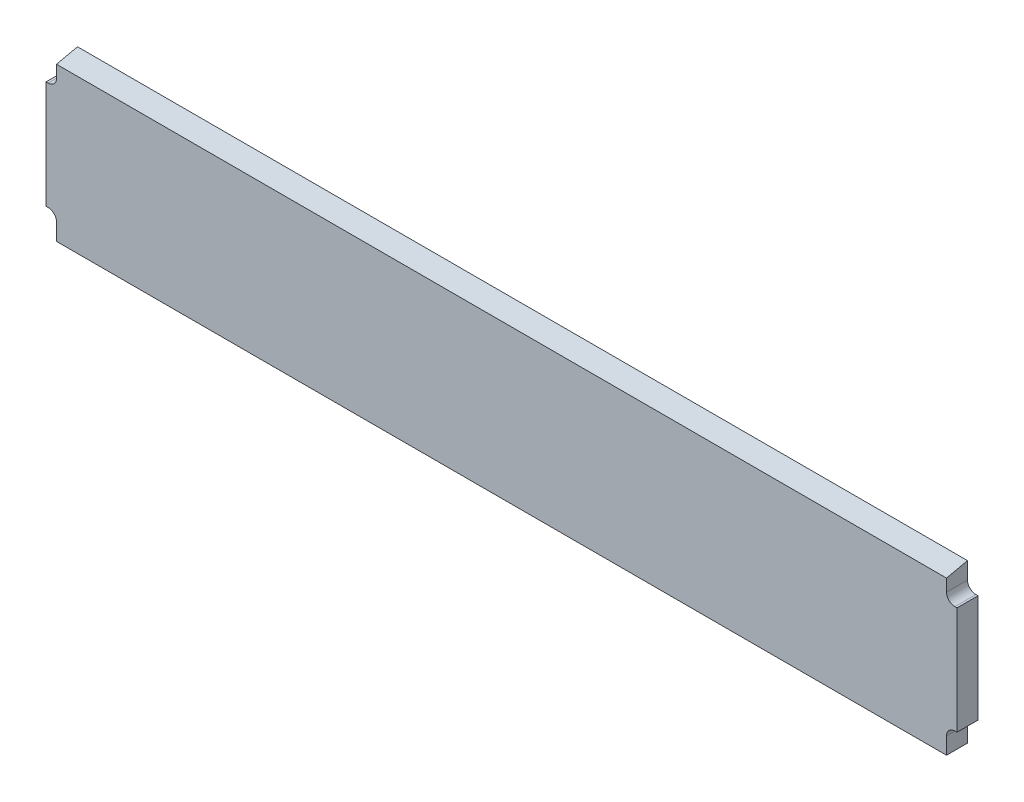
from build123d import *

# Parameters (mm, degrees)
BOSS_EXTRUDE1_DEPTH     = 15.875
FILLET1_R               = 6.35
CUT_EXTRUDE1_DEPTH      = 692.745678075
CUT_EXTRUDE1_DEPTH_BACK = 692.745678075


with BuildPart() as part:
    # Sketch1 → Boss-Extrude1 (new body)
    with BuildSketch(Plane.XY):
        Polygon((-336.55, -40.7289), (-336.55, -59.7789), (336.55, -59.7789), (336.55, -40.7289), (344.4875, -40.7289), (344.4875, 40.7289), (336.55, 40.7289), (336.55, 59.7789), (-336.55, 59.7789), (-336.55, 40.7289), (-344.4875, 40.7289), (-344.4875, -40.7289), align=None)
    extrude(amount=BOSS_EXTRUDE1_DEPTH)

    # Fillet1
    fillet1_edges = [part.edges().sort_by_distance(p)[0] for p in [
        (-336.55, -40.7289, 7.9375),
        (-336.55, 40.7289, 7.9375),
        (336.55, -40.7289, 7.9375),
        (336.55, 40.7289, 7.9375),
    ]]
    fillet(fillet1_edges, radius=FILLET1_R)

    # Sketch2 → Cut-Extrude1 (cut, two sides: drawn at the far end of the back side and taken through both)
    with BuildSketch(Plane(origin=(344.4875, 0, 0), x_dir=(0, 0, -1), z_dir=(1, 0, 0)).offset(-CUT_EXTRUDE1_DEPTH_BACK)):
        Polygon((0, 59.7789), (-15.875, 56.259497231), (-15.875, 59.7789), align=None)
    extrude(amount=CUT_EXTRUDE1_DEPTH + CUT_EXTRUDE1_DEPTH_BACK, mode=Mode.SUBTRACT)


solid = part.part
